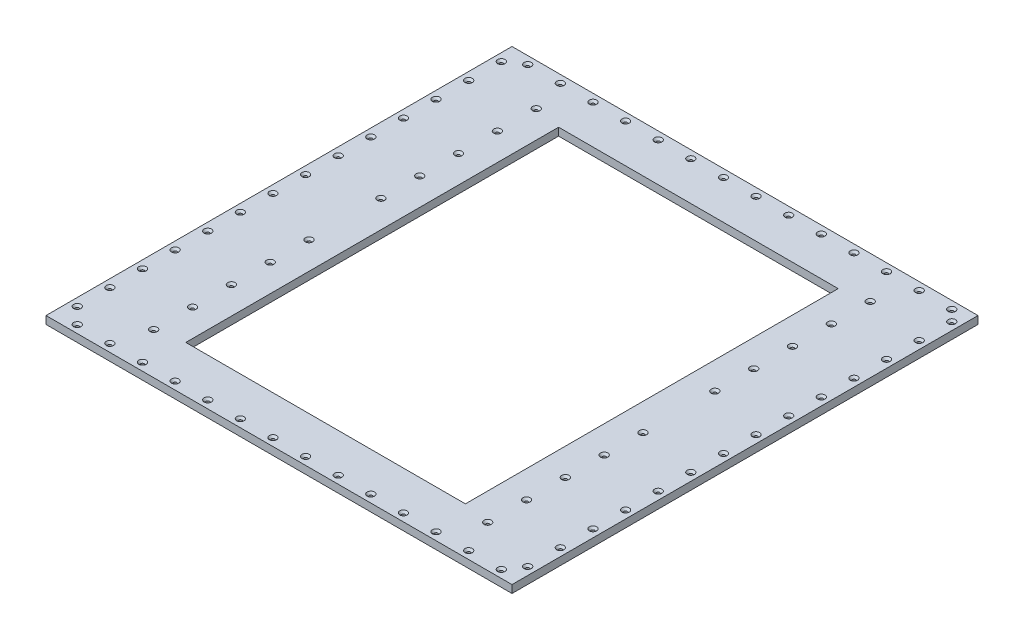
from build123d import *

# Parameters (mm, degrees)
SKETCH1_W                                       = 600
SKETCH1_H                                       = 600
BOSS_EXTRUDE1_DEPTH                             = 10
CSK_FOR_M4_FLAT_HEAD_MACHINE_SCREW1_D           = 4.3
CSK_FOR_M4_FLAT_HEAD_MACHINE_SCREW1_CSINK_D     = 9.4
CSK_FOR_M4_FLAT_HEAD_MACHINE_SCREW1_CSINK_ANGLE = 90
CSK_FOR_M4_FLAT_HEAD_MACHINE_SCREW2_D           = 4.3
CSK_FOR_M4_FLAT_HEAD_MACHINE_SCREW2_CSINK_D     = 9.4
CSK_FOR_M4_FLAT_HEAD_MACHINE_SCREW2_CSINK_ANGLE = 90
SKETCH6_W                                       = 360
SKETCH6_H                                       = 480
CUT_EXTRUDE1_DEPTH                              = 10
SKETCH7_W                                       = 14
SKETCH7_H                                       = 500
CUT_EXTRUDE2_DEPTH                              = 2
CHAMFER1_SIZE                                   = 2


with BuildPart() as part:
    # Sketch1 → Boss-Extrude1 (new body)
    with BuildSketch(Plane(origin=(0, 0, 0), x_dir=(1, 0, 0), z_dir=(0, 1, 0))):
        with Locations((300, 300)):
            Rectangle(SKETCH1_W, SKETCH1_H)
    extrude(amount=BOSS_EXTRUDE1_DEPTH)

    # CSK for M4 Flat Head Machine Screw1 (through all)
    with Locations(Plane(origin=(0, 10, 0), x_dir=(1, 0, 0), z_dir=(0, 1, 0))):
        with Locations((30.25, 10), (72.25, 10), (114.25, 10), (156.25, 10), (198.25, 10), (240.25, 10), (282.25, 10), (324.25, 10), (366.25, 10), (408.25, 10), (450.25, 10), (492.25, 10), (534.25, 10), (576.25, 10), (72.25, 590), (114.25, 590), (156.25, 590), (198.25, 590), (240.25, 590), (282.25, 590), (324.25, 590), (366.25, 590), (408.25, 590), (450.25, 590), (492.25, 590), (534.25, 590), (576.25, 590), (30.25, 590), (590, 30.25), (10, 30.25), (10, 72.25), (10, 114.25), (10, 156.25), (10, 198.25), (10, 240.25), (10, 282.25), (10, 324.25), (10, 366.25), (10, 408.25), (10, 450.25), (10, 492.25), (10, 534.25), (10, 576.25), (590, 72.25), (590, 114.25), (590, 156.25), (590, 198.25), (590, 240.25), (590, 282.25), (590, 324.25), (590, 366.25), (590, 408.25), (590, 450.25), (590, 492.25), (590, 534.25), (590, 576.25)):
            CounterSinkHole(CSK_FOR_M4_FLAT_HEAD_MACHINE_SCREW1_D / 2, CSK_FOR_M4_FLAT_HEAD_MACHINE_SCREW1_CSINK_D / 2, counter_sink_angle=CSK_FOR_M4_FLAT_HEAD_MACHINE_SCREW1_CSINK_ANGLE)

    # CSK for M4 Flat Head Machine Screw2 (through all)
    with Locations(Plane(origin=(0, 10, 0), x_dir=(1, 0, 0), z_dir=(0, 1, 0))):
        with Locations((84.93, 53.75), (514.93, 53.75), (514.93, 103.75), (514.93, 153.75), (514.93, 203.75), (514.93, 253.75), (84.93, 103.75), (84.93, 153.75), (84.93, 203.75), (84.93, 253.75), (84.93, 546.25), (514.93, 546.25), (514.93, 496.25), (514.93, 446.25), (514.93, 396.25), (514.93, 346.25), (84.93, 496.25), (84.93, 446.25), (84.93, 396.25), (84.93, 346.25)):
            CounterSinkHole(CSK_FOR_M4_FLAT_HEAD_MACHINE_SCREW2_D / 2, CSK_FOR_M4_FLAT_HEAD_MACHINE_SCREW2_CSINK_D / 2, counter_sink_angle=CSK_FOR_M4_FLAT_HEAD_MACHINE_SCREW2_CSINK_ANGLE)

    # Sketch6 → Cut-Extrude1 (cut)
    with BuildSketch(Plane(origin=(0, 10, 0), x_dir=(1, 0, 0), z_dir=(0, 1, 0))):
        with Locations((300, 300)):
            Rectangle(SKETCH6_W, SKETCH6_H)
    extrude(amount=-CUT_EXTRUDE1_DEPTH, mode=Mode.SUBTRACT)

    # Sketch7 → Cut-Extrude2 (cut)
    with BuildSketch(Plane.XZ):
        with Locations((65, -300)):
            Rectangle(SKETCH7_W, SKETCH7_H)
        with Locations((105, -300)):
            Rectangle(SKETCH7_W, SKETCH7_H)
        with Locations((535, -300)):
            Rectangle(SKETCH7_W, SKETCH7_H)
        with Locations((495, -300)):
            Rectangle(SKETCH7_W, SKETCH7_H)
    extrude(amount=-CUT_EXTRUDE2_DEPTH, mode=Mode.SUBTRACT)

    # Chamfer1
    chamfer1_edges = [part.edges().sort_by_distance(p)[0] for p in [
        (65, 2, -550),
        (58, 2, -300),
        (65, 2, -50),
        (72, 2, -300),
        (98, 2, -300),
        (105, 2, -50),
        (112, 2, -300),
        (105, 2, -550),
        (488, 2, -300),
        (495, 2, -50),
        (502, 2, -300),
        (495, 2, -550),
        (528, 2, -300),
        (535, 2, -50),
        (542, 2, -300),
        (535, 2, -550),
    ]]
    chamfer(chamfer1_edges, length=CHAMFER1_SIZE - 0.0001)  # a hair under: the kernel refuses the full size


solid = part.part
